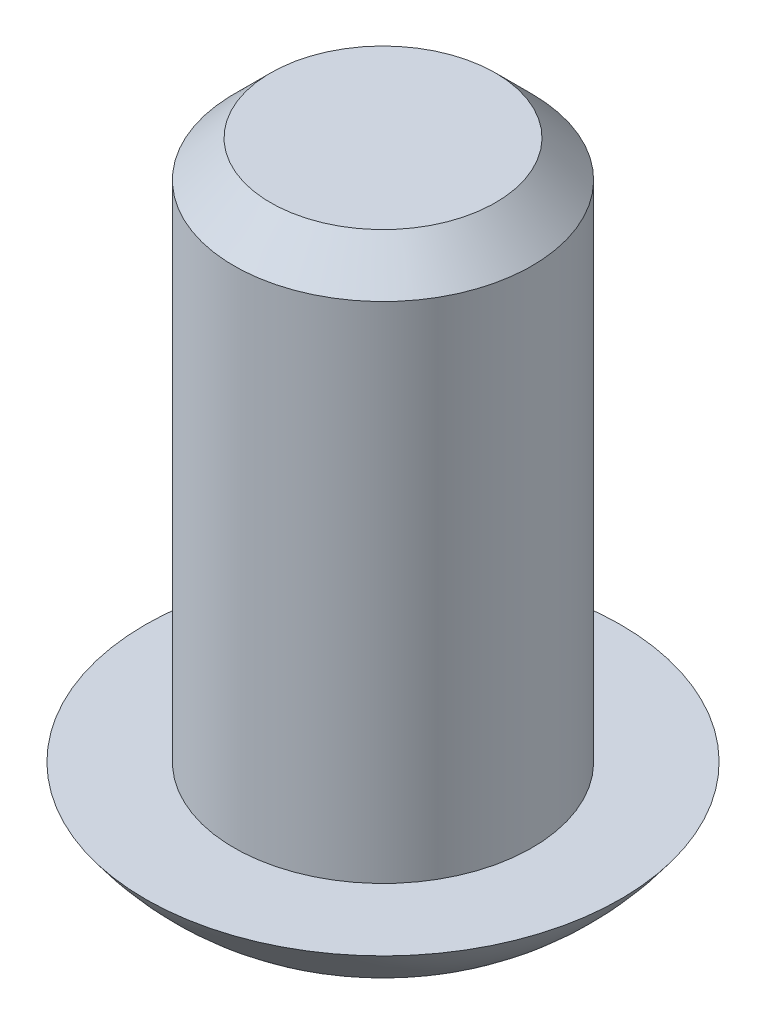
from build123d import *

# Parameters (mm, degrees)
SKETCH1_R           = 0.75
BOSS_EXTRUDE1_DEPTH = 2.54
SKETCH5_W           = 0.967191405
SKETCH5_H           = 0.117048642
SKETCH5_W_2         = 0.110888186
SKETCH5_H_2         = 0.950250154
CUT_EXTRUDE1_DEPTH  = 0.762


# Read off the part's stored shape, not the designer's step: M1.4x0.3 Machine Threads Stud1
with BuildPart() as part:
    # Sketch1 → Boss-Extrude1 (new body)
    with BuildSketch(Plane(origin=(0, 0, 0), x_dir=(1, 0, 0), z_dir=(0, 1, 0))):
        with Locations(Location((0, 0, 0), (0, 0, 270))):
            Circle(SKETCH1_R)
    extrude(amount=BOSS_EXTRUDE1_DEPTH)

    # M1.4x0.3 Machine Threads Stud1 outline → M1.4x0.3 Machine Threads Stud1 (revolve, cut)
    with BuildSketch(Plane.XY):
        Polygon((0.75, 2.54), (0.5285, 2.54), (0.7, 2.3685), (0.7, 0), (0.75, 0), align=None)
    revolve(axis=Axis((0, 0, 0), (0, 1, 0)), mode=Mode.SUBTRACT)

    # Sketch4 → Revolve1 (revolve)
    with BuildSketch(Plane.XY, mode=Mode.PRIVATE) as revolve1_sk:
        with BuildLine():
            add(Edge.make_bspline(
                [(1.116948717, 0), (0.722805152, -0.559065826), (0, -0.478908216)],
                knots=[0, 0, 0, 1, 1, 1], degree=2))
            Line((0, -0.478908216), (0, 0))
            Line((0, 0), (1.116948717, 0))
        make_face()
    revolve(revolve1_sk.sketch.rotate(Axis((0, 0, 0), (0, -1, 0)), 270), axis=Axis((0, 0, 0), (0, -1, 0)))

    # Sketch5 → Cut-Extrude1 (cut)
    with BuildSketch(Plane(origin=(0, -1.000000032, 0), x_dir=(1, 0, 0), z_dir=(0, 1, 0))):
        with Locations((-0.539039796, 0)):
            Rectangle(SKETCH5_W, SKETCH5_H)
        with Locations((0, -0.533649398)):
            Rectangle(SKETCH5_W_2, SKETCH5_H_2)
        with Locations((0.539039796, 0)):
            Rectangle(SKETCH5_W, SKETCH5_H)
        with Locations((0, 0.533649398)):
            Rectangle(SKETCH5_W_2, SKETCH5_H_2)
        Rectangle(SKETCH5_W_2, SKETCH5_H)
    extrude(amount=CUT_EXTRUDE1_DEPTH, mode=Mode.SUBTRACT)


solid = part.part
